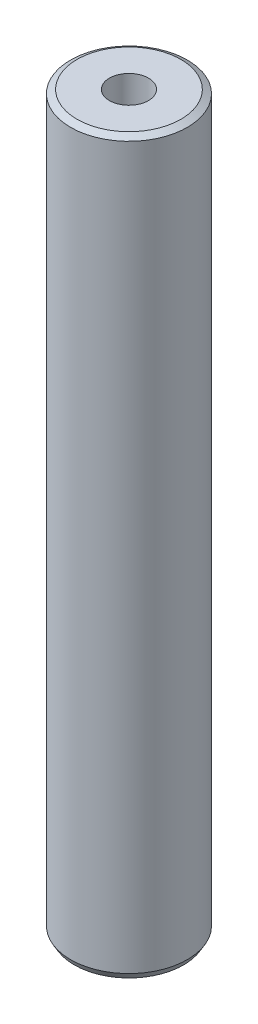
from build123d import *
from OCP.BRepFilletAPI import BRepFilletAPI_MakeChamfer

# Parameters (mm, degrees)
SKETCH1_R           = 17.5
BOSS_EXTRUDE1_DEPTH = 219.123057403
SKETCH2_R           = 5.851427026
CUT_EXTRUDE1_DEPTH  = 221.516244947
CHAMFER1_SIZE       = 1.120442864
CHAMFER1_SIZE2      = 1.940663968


with BuildPart() as part:
    # Sketch1 → Boss-Extrude1 (new body)
    with BuildSketch(Plane(origin=(0, 0, 0), x_dir=(1, 0, 0), z_dir=(0, 1, 0))):
        Circle(SKETCH1_R)
    extrude(amount=BOSS_EXTRUDE1_DEPTH)

    # Sketch2 → Cut-Extrude1 (cut, through all)
    with BuildSketch(Plane(origin=(0, 0, 0), x_dir=(1, 0, 0), z_dir=(0, 1, 0))):
        Circle(SKETCH2_R)
    extrude(amount=CUT_EXTRUDE1_DEPTH, mode=Mode.SUBTRACT)

    # Chamfer1: one chamfer whose edges measure the first distance from different faces: ONE call of the kernel's chamfer builder (chamfer() names one face for all edges)
    chamfer1_edges_1 = [part.edges().sort_by_distance(p)[0] for p in [
        (-17.5, 219.123057403, 0),
    ]]
    chamfer1_side_1 = [part.faces().sort_by_distance(p)[0] for p in [
        (-17.5, 109.561528701, 0),
    ]]
    chamfer1_edges_2 = [part.edges().sort_by_distance(p)[0] for p in [
        (-17.5, 0, 0),
    ]]
    chamfer1_side_2 = [part.faces().sort_by_distance(p)[0] for p in [
        (-17.005025253, 0, 0),
    ]]
    chamfer1 = BRepFilletAPI_MakeChamfer(part.part.solid().wrapped)
    for e in chamfer1_edges_1:
        chamfer1.Add(CHAMFER1_SIZE, CHAMFER1_SIZE2, e.wrapped, chamfer1_side_1[0].wrapped)  # the first distance lies on this face
    for e in chamfer1_edges_2:
        chamfer1.Add(CHAMFER1_SIZE, CHAMFER1_SIZE2, e.wrapped, chamfer1_side_2[0].wrapped)  # the first distance lies on this face
    add(Compound.cast(chamfer1.Shape()), mode=Mode.REPLACE)


solid = part.part
